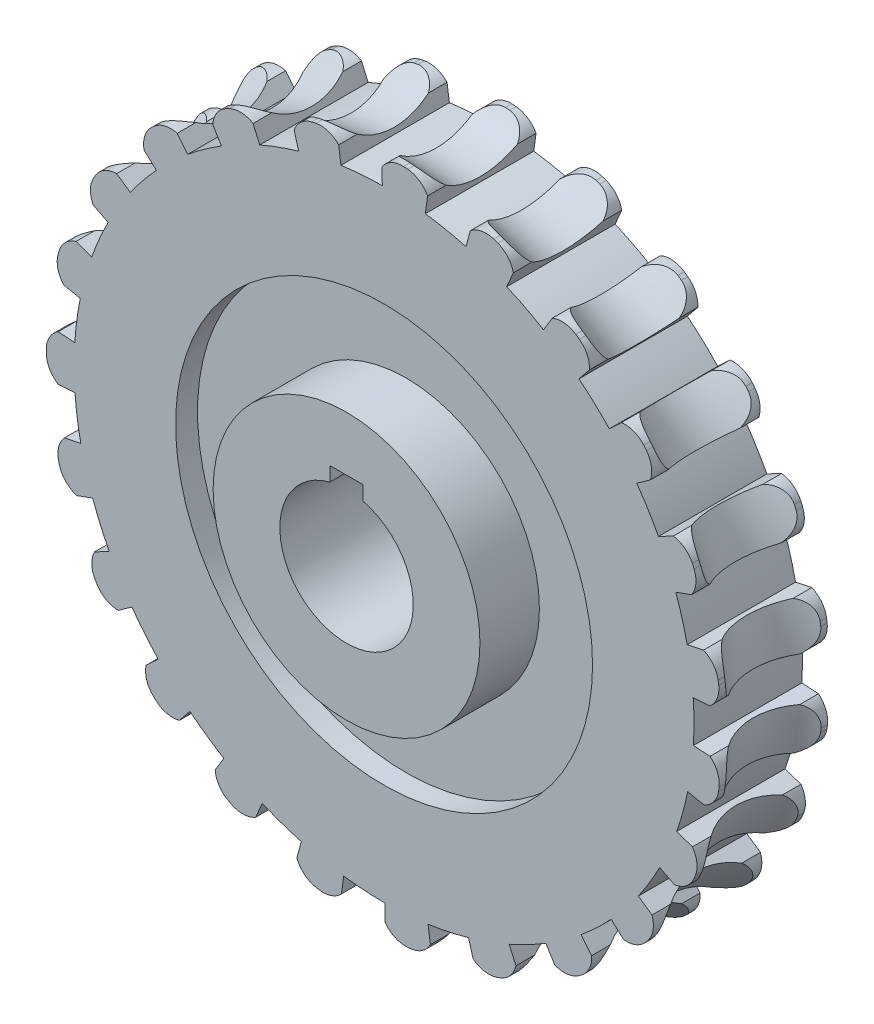
from build123d import *

# Parameters (mm, degrees)
SKETCH2_R           = 121.5
BOSS_EXTRUDE1_DEPTH = 19.5
SKETCH3_R           = 48
BOSS_EXTRUDE3_DEPTH = 33
SKETCH4_R           = 75
SKETCH4_R_2         = 48
CUT_EXTRUDE2_DEPTH  = 7.89
SKETCH6_R           = 22.5
CUT_EXTRUDE3_DEPTH  = 175.967139772
CIRPATTERN2_COUNT   = 23


with BuildPart() as part:
    # Sketch2 → Boss-Extrude1 (new, symmetric)
    with BuildSketch(Plane.XY):
        Circle(SKETCH2_R)
        with BuildLine():
            Line((-6, 28.377900077), (6, 28.377900077))
            Line((6, 28.377900077), (6, 23.237900077))
            ThreePointArc((6, 23.237900077), (0, -24), (-6, 23.237900077))
            Line((-6, 23.237900077), (-6, 28.377900077))
        make_face(mode=Mode.SUBTRACT)
    extrude(amount=BOSS_EXTRUDE1_DEPTH, both=True)

    # Sketch3 → Boss-Extrude3 (add, symmetric)
    with BuildSketch(Plane.XY):
        Circle(SKETCH3_R)
        with BuildLine():
            Line((6, 23.237900077), (6, 28.377900077))
            Line((6, 28.377900077), (-6, 28.377900077))
            Line((-6, 28.377900077), (-6, 23.237900077))
            ThreePointArc((-6, 23.237900077), (0, -24), (6, 23.237900077))
        make_face(mode=Mode.SUBTRACT)
    extrude(amount=BOSS_EXTRUDE3_DEPTH, both=True)

    # Sketch4 → Cut-Extrude2 (cut)
    with BuildSketch(Plane.XY.offset(19.5)):
        Circle(SKETCH4_R)
        Circle(SKETCH4_R_2, mode=Mode.SUBTRACT)
    cut_extrude2 = extrude(amount=-CUT_EXTRUDE2_DEPTH, mode=Mode.SUBTRACT)

    # Mirror1: Cut-Extrude2 across plane
    add(cut_extrude2.mirror(Plane.XY), mode=Mode.SUBTRACT)

    # Sketch6 → Cut-Revolve1 (revolve, cut)
    with BuildSketch(Plane(origin=(0, 0, 0), x_dir=(0, 0, -1), z_dir=(1, 0, 0))):
        with Locations((0, -136)):
            Circle(SKETCH6_R)
    revolve(axis=Axis((0, 0, 0), (0, 0, -1)), mode=Mode.SUBTRACT)

    # Sketch7 → Cut-Extrude3 (cut, symmetric)
    with BuildSketch(Plane.XY):
        with BuildLine():
            ThreePointArc((8.534865434, 121.199860033), (12.698955966, 119.72760668), (15.661217256, 116.451604858))
            Line((15.661217256, 116.451604858), (14.861495524, 110.505139929))
            ThreePointArc((14.861495524, 110.505139929), (22.209237339, 109.265730112), (29.457787309, 107.538313019))
            Line((29.457787309, 107.538313019), (31.04295972, 113.325128069))
            ThreePointArc((31.04295972, 113.325128069), (35.049081218, 115.184743737), (39.457502614, 114.914557335))
            ThreePointArc((39.457502614, 114.914557335), (24.20109719, 119.065347162), (8.534865434, 121.199860033))
        make_face()
    cut_extrude3 = extrude(amount=CUT_EXTRUDE3_DEPTH, both=True, mode=Mode.SUBTRACT)

    # CirPattern2: Cut-Extrude3 ×23 about axis
    cirpattern2_axis = Axis((0, 0, 19.5), (0, 0, 1))
    for i in range(1, CIRPATTERN2_COUNT):
        add(cut_extrude3.rotate(cirpattern2_axis, i * 360 / CIRPATTERN2_COUNT), mode=Mode.SUBTRACT)


solid = part.part
